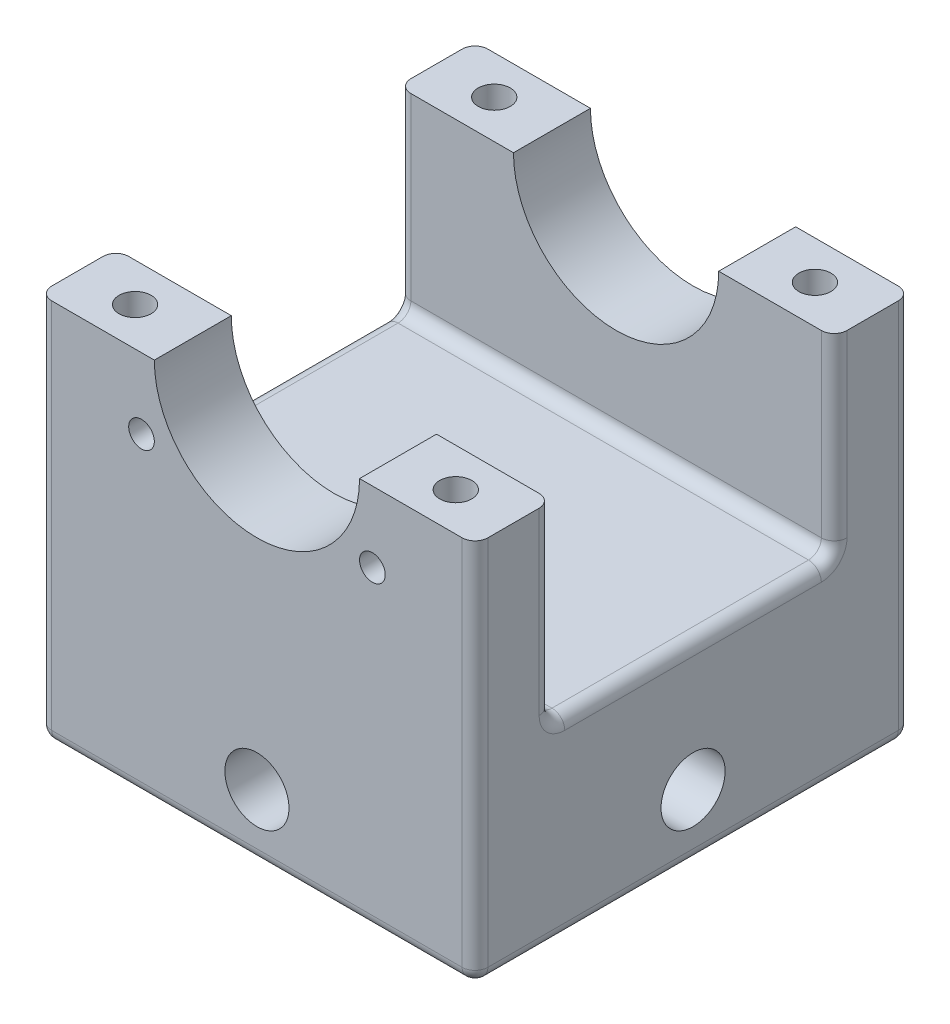
from build123d import *

# Parameters (mm, degrees)
SKETCH1_W           = 34
SKETCH1_H           = 34
BOSS_EXTRUDE1_DEPTH = 15
SKETCH2_W           = 20.2
SKETCH2_H           = 20.2
CUT_EXTRUDE1_DEPTH  = 10
SKETCH4_W           = 34
SKETCH4_H           = 15
BOSS_EXTRUDE2_DEPTH = 6
SKETCH7_R           = 8
CUT_EXTRUDE4_DEPTH  = 49.425200051
SKETCH17_R          = 1.25
CUT_EXTRUDE10_DEPTH = 10
SKETCH15_R          = 2.5
CUT_EXTRUDE8_DEPTH  = 49.425200051
SKETCH16_R          = 2.5
CUT_EXTRUDE9_DEPTH  = 49.425200051
FILLET2_R           = 1
SKETCH19_R          = 1
CUT_EXTRUDE12_DEPTH = 3


with BuildPart() as part:
    # Sketch1 → Boss-Extrude1 (new body)
    with BuildSketch(Plane(origin=(0, 0, 0), x_dir=(1, 0, 0), z_dir=(0, 1, 0))):
        Rectangle(SKETCH1_W, SKETCH1_H)
    extrude(amount=BOSS_EXTRUDE1_DEPTH)

    # Sketch2 → Cut-Extrude1 (cut)
    with BuildSketch(Plane.XZ):
        Rectangle(SKETCH2_W, SKETCH2_H)
    extrude(amount=-CUT_EXTRUDE1_DEPTH, mode=Mode.SUBTRACT)

    # Sketch4 → Boss-Extrude2 (add)
    with BuildSketch(Plane.XY.offset(17)):
        with Locations((0, 22.5)):
            Rectangle(SKETCH4_W, SKETCH4_H)
    boss_extrude2 = extrude(amount=-BOSS_EXTRUDE2_DEPTH)

    # Sketch7 → Cut-Extrude4 (cut, through all)
    with BuildSketch(Plane.XY.offset(17)):
        with Locations((0, 30)):
            Circle(SKETCH7_R)
    cut_extrude4 = extrude(amount=-CUT_EXTRUDE4_DEPTH, mode=Mode.SUBTRACT)

    # Sketch17 → Cut-Extrude10 (cut)
    with BuildSketch(Plane(origin=(0, 30, 0), x_dir=(1, 0, 0), z_dir=(0, 1, 0))):
        with Locations((-12.5, -14)):
            Circle(SKETCH17_R)
        with Locations((12.5, -14)):
            Circle(SKETCH17_R)
    cut_extrude10 = extrude(amount=-CUT_EXTRUDE10_DEPTH, mode=Mode.SUBTRACT)

    # Mirror1: Boss-Extrude2, Cut-Extrude4, Cut-Extrude10 across plane
    add(boss_extrude2.mirror(Plane.XY))
    add(cut_extrude4.mirror(Plane.XY), mode=Mode.SUBTRACT)
    add(cut_extrude10.mirror(Plane.XY), mode=Mode.SUBTRACT)

    # Sketch15 → Cut-Extrude8 (cut, through all)
    with BuildSketch(Plane(origin=(0, 0, -17), x_dir=(-1, 0, 0), z_dir=(0, 0, -1))):
        with Locations((0, 5)):
            Circle(SKETCH15_R)
    extrude(amount=-CUT_EXTRUDE8_DEPTH, mode=Mode.SUBTRACT)

    # Sketch16 → Cut-Extrude9 (cut, through all)
    with BuildSketch(Plane(origin=(17, 0, 0), x_dir=(0, 0, -1), z_dir=(1, 0, 0))):
        with Locations((0, 5)):
            Circle(SKETCH16_R)
    extrude(amount=-CUT_EXTRUDE9_DEPTH, mode=Mode.SUBTRACT)

    # Fillet2
    fillet2_edges = [part.edges().sort_by_distance(p)[0] for p in [
        (17, 15, -17),
        (-17, 15, 17),
        (17, 15, 17),
        (-17, 0, 0),
        (0, 0, -17),
        (17, 0, 0),
        (0, 0, 17),
        (-17, 15, -17),
        (-17, 22.5, 11),
        (17, 22.5, 11),
        (0, 15, 11),
        (-17, 15, 0),
        (17, 15, 0),
        (17, 22.5, -11),
        (0, 15, -11),
        (-17, 22.5, -11),
    ]]
    fillet(fillet2_edges, radius=FILLET2_R)

    # Sketch19 → Cut-Extrude12 (cut)
    with BuildSketch(Plane.XY.offset(17)):
        with Locations((-9, 24.5)):
            Circle(SKETCH19_R)
    cut_extrude12 = extrude(amount=-CUT_EXTRUDE12_DEPTH, mode=Mode.SUBTRACT)

    # Mirror2: Cut-Extrude12 across plane
    add(cut_extrude12.mirror(Plane(origin=(0, 0, 0), x_dir=(0, 0, 1), z_dir=(1, 0, 0))), mode=Mode.SUBTRACT)


solid = part.part
